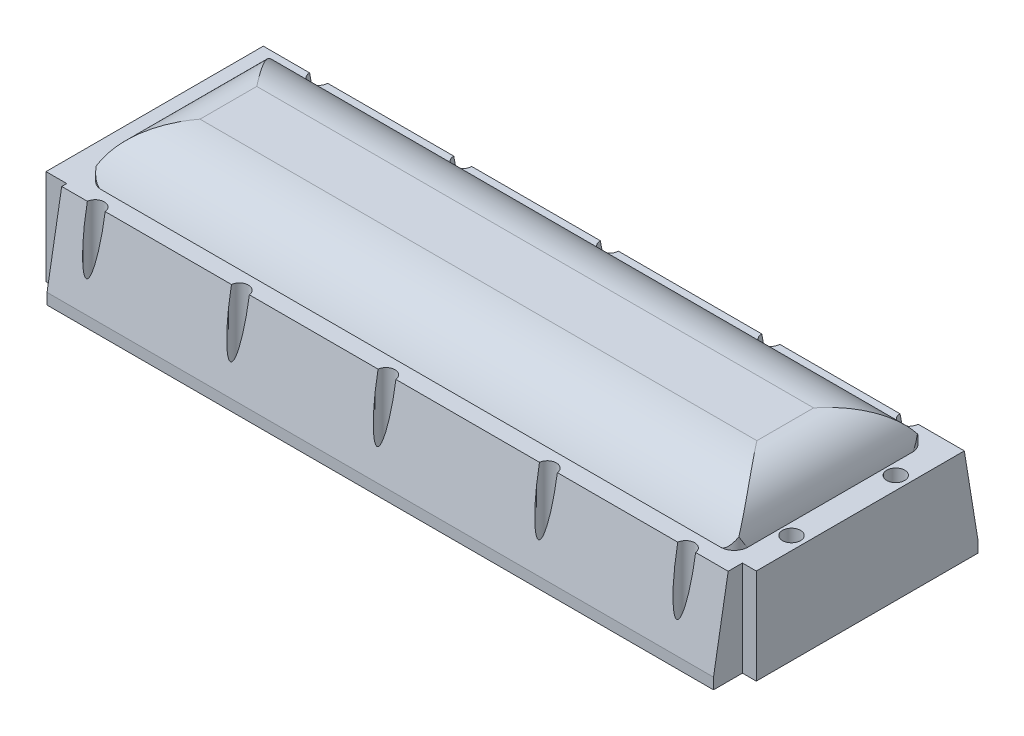
from build123d import *

# Parameters (mm, degrees)
SALIENTE_EXTRUIR1_DEPTH                              = 100
CROQUIS3_W                                           = 19.61
CROQUIS3_H                                           = 92
CROQUIS3_W_2                                         = 14.25
CORTAR_EXTRUIR2_DEPTH                                = 1047
CROQUIS4_W                                           = 21.4
CROQUIS4_H                                           = 92
CORTAR_EXTRUIR3_DEPTH                                = 1047
CROQUIS5_W                                           = 17.94
CROQUIS5_H                                           = 92
CORTAR_EXTRUIR4_DEPTH                                = 1047
CROQUIS6_W                                           = 465.66
CROQUIS6_H                                           = 136.76
CORTAR_EXTRUIR5_DEPTH                                = 65
REFRENTADO_PARA_PERNO_CON_CABEZA_HEXAGON_D           = 10.5
REFRENTADO_PARA_PERNO_CON_CABEZA_HEXAGON_DEPTH       = 90
REFRENTADO_PARA_PERNO_CON_CABEZA_HEXAGON_CBORE_D     = 13
REFRENTADO_PARA_PERNO_CON_CABEZA_HEXAGON_CBORE_DEPTH = 6.85
REFRENTADO_PARA_PERNO_CON_CABEZA_HEXAGON_TIP         = 3.15451825
CROQUIS11_R                                          = 8.5
CORTAR_EXTRUIR6_DEPTH                                = 211
CORTAR_EXTRUIR7_DEPTH                                = 528.891843468
CORTAR_EXTRUIR9_DEPTH                                = 211
REDONDEO1_R                                          = 10
REDONDEO2_R                                          = 10
REDONDEO3_R                                          = 10
REDONDEO4_R                                          = 10
CHAFL_N1_SIZE                                        = 1
REDONDEO5_R                                          = 10
SALIENTE_EXTRUIR2_START                              = 61
CROQUIS14_R                                          = 6.5
SALIENTE_EXTRUIR2_DEPTH                              = 61
CORTAR_EXTRUIR10_DEPTH                               = 550
CORTAR_EXTRUIR11_DEPTH                               = 550
CORTAR_EXTRUIR12_START                               = -550
CROQUIS18_R                                          = 8.5
CORTAR_EXTRUIR12_DEPTH                               = 550


# Some blends are built 0.0001 mm under size
with BuildPart() as part:
    # Croquis2 → Saliente-Extruir1 (new body)
    with BuildSketch(Plane(origin=(0, 0, 0), x_dir=(1, 0, 0), z_dir=(0, 1, 0))):
        Polygon((-256, 14.25), (-256, 181.28), (251, 181.28), (251, 20.92), (241, 20.92), (241, 0), (-241, 0), (-241, 14.25), align=None)
    extrude(amount=SALIENTE_EXTRUIR1_DEPTH)

    # Croquis3 → Cortar-Extruir2 (cut)
    with BuildSketch(Plane.ZY.offset(256)):
        with Locations((-171.475, 54)):
            Rectangle(CROQUIS3_W, CROQUIS3_H)
        with Locations((-7.125, 54)):
            Rectangle(CROQUIS3_W_2, CROQUIS3_H)
        Polygon((-14.25, 100), (-20.92, 100), (-22.91, 100), (-22.91, 8), (-14.25, 8), align=None)
    extrude(amount=-CORTAR_EXTRUIR2_DEPTH, mode=Mode.SUBTRACT)

    # Croquis4 → Cortar-Extruir3 (cut)
    with BuildSketch(Plane(origin=(0, 0, -161.67), x_dir=(-1, 0, 0), z_dir=(0, 0, -1))):
        with Locations((245.3, 54)):
            Rectangle(CROQUIS4_W, CROQUIS4_H)
    extrude(amount=-CORTAR_EXTRUIR3_DEPTH, mode=Mode.SUBTRACT)

    # Croquis5 → Cortar-Extruir4 (cut)
    with BuildSketch(Plane(origin=(0, 0, -161.67), x_dir=(-1, 0, 0), z_dir=(0, 0, -1))):
        with Locations((-242.03, 54)):
            Rectangle(CROQUIS5_W, CROQUIS5_H)
    extrude(amount=-CORTAR_EXTRUIR4_DEPTH, mode=Mode.SUBTRACT)

    # Croquis6 → Cortar-Extruir5 (cut)
    with BuildSketch(Plane.XZ):
        with Locations((-0.77, -92.29)):
            Rectangle(CROQUIS6_W, CROQUIS6_H)
    extrude(amount=-CORTAR_EXTRUIR5_DEPTH, mode=Mode.SUBTRACT)

    # Refrentado para perno con cabeza hexagonal de M101
    with Locations(Plane(origin=(-216, 8, -9.875), x_dir=(0, 0, 1), z_dir=(0, 1, 0))):
        with Locations((0, 0), (0, 104.25), (0, 210.25), (0, 327), (0, 427), (-46.045, 457.5), (-121.405, 457.5), (-161.53, 427), (-161.53, 327), (-161.53, 210.25), (-161.53, 104.25), (-161.53, 0)):
            CounterBoreHole(REFRENTADO_PARA_PERNO_CON_CABEZA_HEXAGON_D / 2, REFRENTADO_PARA_PERNO_CON_CABEZA_HEXAGON_CBORE_D / 2, REFRENTADO_PARA_PERNO_CON_CABEZA_HEXAGON_CBORE_DEPTH, depth=REFRENTADO_PARA_PERNO_CON_CABEZA_HEXAGON_DEPTH)
            with Locations((0, 0, -(REFRENTADO_PARA_PERNO_CON_CABEZA_HEXAGON_DEPTH + REFRENTADO_PARA_PERNO_CON_CABEZA_HEXAGON_TIP / 2))):  # 118° drill point
                Cone(0, REFRENTADO_PARA_PERNO_CON_CABEZA_HEXAGON_D / 2, REFRENTADO_PARA_PERNO_CON_CABEZA_HEXAGON_TIP, mode=Mode.SUBTRACT)

    # Croquis11 → Cortar-Extruir6 (cut)
    with BuildSketch(Plane.ZY.offset(234.6)):
        with Locations((-136.94, 22)):
            Circle(CROQUIS11_R)
        with Locations((-50.94, 22)):
            Circle(CROQUIS11_R)
    extrude(amount=-CORTAR_EXTRUIR6_DEPTH, mode=Mode.SUBTRACT)

    # Croquis12 → Cortar-Extruir7 (cut, through all)
    with BuildSketch(Plane.ZY.offset(234.6)):
        with BuildLine():
            ThreePointArc((-161.67, 69), (-141.744018282, 91.596052461), (-112.813065999, 100))
            Line((-112.813065999, 100), (-161.67, 100))
            Line((-161.67, 100), (-161.67, 69))
        make_face()
        with BuildLine():
            Line((-22.91, 100), (-71.766934001, 100))
            ThreePointArc((-71.766934001, 100), (-42.835981718, 91.596052461), (-22.91, 69))
            Line((-22.91, 69), (-22.91, 100))
        make_face()
    extrude(amount=-CORTAR_EXTRUIR7_DEPTH, mode=Mode.SUBTRACT)

    # Croquis13 → Cortar-Extruir9 (cut)
    with BuildSketch(Plane(origin=(0, 0, -161.67), x_dir=(-1, 0, 0), z_dir=(0, 0, -1))):
        with BuildLine():
            Line((-200.594633839, 100), (-233.06, 100))
            Line((-233.06, 100), (-233.06, 69))
            ThreePointArc((-233.06, 69), (-223.039009526, 91.005318547), (-200.594633839, 100))
        make_face()
        with BuildLine():
            Line((234.6, 69), (234.6, 100))
            Line((234.6, 100), (202.134633839, 100))
            ThreePointArc((202.134633839, 100), (224.579009526, 91.005318547), (234.6, 69))
        make_face()
    extrude(amount=-CORTAR_EXTRUIR9_DEPTH, mode=Mode.SUBTRACT)

    # Redondeo1
    redondeo1_edges = [part.edges().sort_by_distance(p)[0] for p in [
        (-233.6, 65, -92.29),
        (-233.6, 32.5, -160.67),
        (-233.6, 32.5, -23.91),
    ]]
    fillet(redondeo1_edges, radius=REDONDEO1_R)

    # Redondeo2
    redondeo2_edges = [part.edges().sort_by_distance(p)[0] for p in [
        (232.06, 32.5, -23.91),
    ]]
    fillet(redondeo2_edges, radius=REDONDEO2_R)

    # Redondeo3
    redondeo3_edges = [part.edges().sort_by_distance(p)[0] for p in [
        (232.06, 32.5, -160.67),
    ]]
    fillet(redondeo3_edges, radius=REDONDEO3_R)

    # Redondeo4
    # the kernel refuses this fillet: 10 mm, written as the material it adds along each edge
    with BuildSketch(Plane(origin=(-223.6, 55, -33.91), x_dir=(0, 1, 0), z_dir=(0, 0, 1))) as redondeo4_piece_1_section:
        Polygon((0, 0), (REDONDEO4_R, 0), (REDONDEO4_R, REDONDEO4_R), (0, REDONDEO4_R), align=None)
    redondeo4_piece_1 = extrude(amount=REDONDEO4_R, mode=Mode.PRIVATE)
    redondeo4_piece_1 = redondeo4_piece_1 - Plane(origin=(-223.6, 55, -33.91), x_dir=(0.7071067811865475, -0.7071067811865475, 0), z_dir=(0, 0, 1)) * Sphere(REDONDEO4_R, mode=Mode.PRIVATE)
    add(redondeo4_piece_1)
    with BuildSketch(Plane(origin=(-223.6, 55, -150.67), x_dir=(0, 1, 0), z_dir=(0, 0, -1))) as redondeo4_piece_2_section:
        Polygon((0, 0), (REDONDEO4_R, 0), (REDONDEO4_R, -REDONDEO4_R), (0, -REDONDEO4_R), align=None)
    redondeo4_piece_2 = extrude(amount=REDONDEO4_R, mode=Mode.PRIVATE)
    redondeo4_piece_2 = redondeo4_piece_2 - Plane(origin=(-223.6, 55, -150.67), x_dir=(0.7071067811865475, -0.7071067811865475, 0), z_dir=(0, 0, -1)) * Sphere(REDONDEO4_R, mode=Mode.PRIVATE)
    add(redondeo4_piece_2)
    with BuildSketch(Plane(origin=(-223.6, 65, -160.67), x_dir=(0, -1, 0), z_dir=(1, 0, 0)), Plane(origin=(222.06, 65, -23.91), x_dir=(0, -1, 0), z_dir=(-1, 0, 0))) as redondeo4_piece_3:
        with BuildLine():
            CenterArc((REDONDEO4_R, -REDONDEO4_R), REDONDEO4_R, 90, 90)
            Line((0, -REDONDEO4_R), (0, 0))
            Line((0, 0), (REDONDEO4_R, 0))
        make_face()
    extrude(amount=445.66)
    with BuildSketch(Plane(origin=(222.06, 65, -33.91), x_dir=(1, 0, 0), z_dir=(0, 0, -1))) as redondeo4_piece_4:
        with BuildLine():
            CenterArc((10 - REDONDEO4_R, REDONDEO4_R), REDONDEO4_R, 270, 90)
            Line((10 - REDONDEO4_R, 0), (10, 0))
            Line((10, 0), (10, REDONDEO4_R))
        make_face()
    revolve(axis=Axis((222.06, 65, -33.91), (0, -1, 0)), revolution_arc=90)
    with BuildSketch(Plane(origin=(232.06, 65, -150.67), x_dir=(0, -1, 0), z_dir=(0, 0, 1))) as redondeo4_piece_5:
        with BuildLine():
            CenterArc((REDONDEO4_R, -REDONDEO4_R), REDONDEO4_R, 90, 90)
            Line((0, -REDONDEO4_R), (0, 0))
            Line((0, 0), (REDONDEO4_R, 0))
        make_face()
    extrude(amount=116.76)
    with BuildSketch(Plane(origin=(222.06, 65, -150.67), x_dir=(1, 0, 0), z_dir=(0, 0, 1))) as redondeo4_piece_6:
        with BuildLine():
            CenterArc((10 - REDONDEO4_R, -REDONDEO4_R), REDONDEO4_R, 0, 90)
            Line((10 - REDONDEO4_R, 0), (10, 0))
            Line((10, 0), (10, -REDONDEO4_R))
        make_face()
    revolve(axis=Axis((222.06, 65, -150.67), (0, 1, 0)), revolution_arc=90)

    # Chaflán1
    chafl_n1_edges = [part.edges().sort_by_distance(p)[0] for p in [
        (-233.6, 22, -145.44),
        (-233.6, 22, -59.44),
    ]]
    chamfer(chafl_n1_edges, length=CHAFL_N1_SIZE - 0.0001)  # a hair under: the kernel refuses the full size

    # Redondeo5
    redondeo5_edges = [part.edges().sort_by_distance(p)[0] for p in [
        (-234.6, 38.5, -161.67),
        (-234.6, 38.5, -22.91),
        (233.06, 38.5, -22.91),
        (233.06, 38.5, -161.67),
    ]]
    fillet(redondeo5_edges, radius=REDONDEO5_R)

    # Croquis14 → Saliente-Extruir2 (add)
    with BuildSketch(Plane(origin=(0, 8, 0), x_dir=(1, 0, 0), z_dir=(0, 1, 0)).offset(SALIENTE_EXTRUIR2_START)):
        Polygon((-241, 14.25), (-241, 0), (241, 0), (241, 20.92), (251, 20.92), (251, 181.28), (-256, 181.28), (-256, 14.25), align=None)
        with Locations(Location((-216, 9.875, 0), (0, 0, 270))):
            Circle(CROQUIS14_R, mode=Mode.SUBTRACT)
        with Locations(Location((-216, 171.405, 0), (0, 0, 270))):
            Circle(CROQUIS14_R, mode=Mode.SUBTRACT)
        with Locations(Location((-111.75, 171.405, 0), (0, 0, 270))):
            Circle(CROQUIS14_R, mode=Mode.SUBTRACT)
        with Locations(Location((-5.75, 171.405, 0), (0, 0, 270))):
            Circle(CROQUIS14_R, mode=Mode.SUBTRACT)
        with Locations(Location((111, 171.405, 0), (0, 0, 270))):
            Circle(CROQUIS14_R, mode=Mode.SUBTRACT)
        with Locations(Location((211, 171.405, 0), (0, 0, 270))):
            Circle(CROQUIS14_R, mode=Mode.SUBTRACT)
        with Locations(Location((241.5, 131.28, 0), (0, 0, 270))):
            Circle(CROQUIS14_R, mode=Mode.SUBTRACT)
        with Locations(Location((241.5, 55.92, 0), (0, 0, 270))):
            Circle(CROQUIS14_R, mode=Mode.SUBTRACT)
        with Locations(Location((211, 9.875, 0), (0, 0, 270))):
            Circle(CROQUIS14_R, mode=Mode.SUBTRACT)
        with Locations(Location((111, 9.875, 0), (0, 0, 270))):
            Circle(CROQUIS14_R, mode=Mode.SUBTRACT)
        with Locations(Location((-5.75, 9.875, 0), (0, 0, 270))):
            Circle(CROQUIS14_R, mode=Mode.SUBTRACT)
        with Locations(Location((-111.75, 9.875, 0), (0, 0, 270))):
            Circle(CROQUIS14_R, mode=Mode.SUBTRACT)
        with BuildLine():
            Line((-234.6, 32.91), (-234.6, 151.67))
            ThreePointArc((-234.6, 151.67), (-231.671067812, 158.741067812), (-224.6, 161.67))
            Line((-224.6, 161.67), (223.06, 161.67))
            ThreePointArc((223.06, 161.67), (230.131067812, 158.741067812), (233.06, 151.67))
            Line((233.06, 151.67), (233.06, 32.91))
            ThreePointArc((233.06, 32.91), (230.131067812, 25.838932188), (223.06, 22.91))
            Line((223.06, 22.91), (-224.6, 22.91))
            ThreePointArc((-224.6, 22.91), (-231.671067812, 25.838932188), (-234.6, 32.91))
        make_face(mode=Mode.SUBTRACT)
    extrude(amount=-SALIENTE_EXTRUIR2_DEPTH)

    # Croquis15 → Cortar-Extruir10 (cut)
    with BuildSketch(Plane(origin=(241, 0, 0), x_dir=(0, 0, -1), z_dir=(1, 0, 0))):
        Polygon((0, 8), (10.604436087, 69), (0, 69), align=None)
    extrude(amount=-CORTAR_EXTRUIR10_DEPTH, mode=Mode.SUBTRACT)

    # Croquis16 → Cortar-Extruir11 (cut)
    with BuildSketch(Plane(origin=(251, 0, 0), x_dir=(0, 0, -1), z_dir=(1, 0, 0))):
        Polygon((171.405, 69), (181.28, 69), (181.28, 8), align=None)
    extrude(amount=-CORTAR_EXTRUIR11_DEPTH, mode=Mode.SUBTRACT)

    # Croquis18 → Cortar-Extruir12 (cut)
    with BuildSketch(Plane(origin=(-234.6, 0, 0), x_dir=(0, 0, -1), z_dir=(1, 0, 0)).offset(CORTAR_EXTRUIR12_START)):
        with Locations((136.94, 22)):
            Circle(CROQUIS18_R)
        with Locations((50.94, 22)):
            Circle(CROQUIS18_R)
    extrude(amount=CORTAR_EXTRUIR12_DEPTH, mode=Mode.SUBTRACT)


solid = part.part
